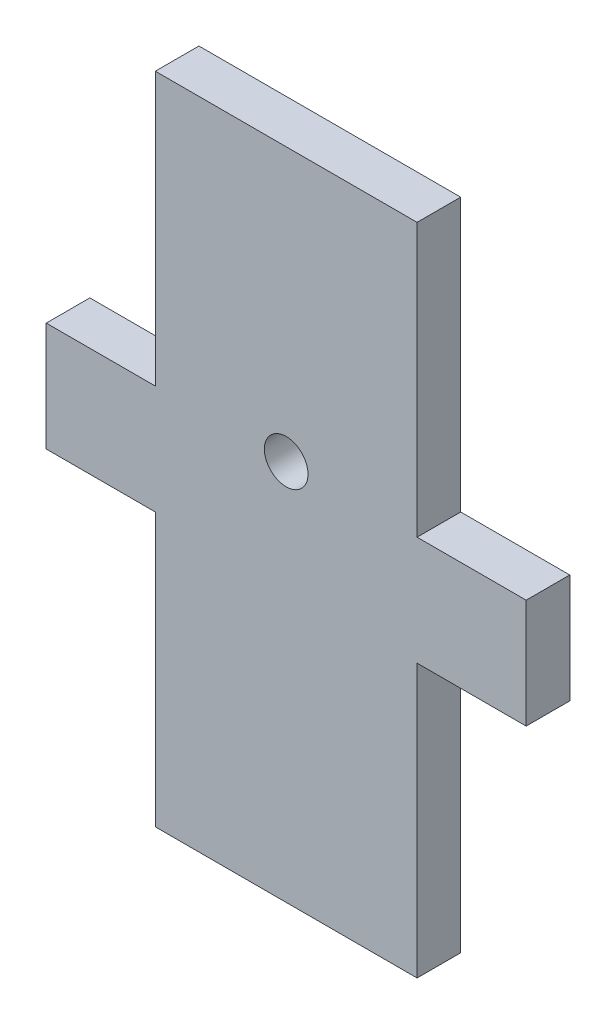
from build123d import *

# Parameters (mm, degrees)
SKETCH1_W           = 60
SKETCH1_H           = 150
BOSS_EXTRUDE1_DEPTH = 10
BOSS_EXTRUDE2_DEPTH = 10
SKETCH3_R           = 5
CUT_EXTRUDE1_DEPTH  = 10


with BuildPart() as part:
    # Sketch1 → Boss-Extrude1 (new body)
    with BuildSketch(Plane.XY):
        Rectangle(SKETCH1_W, SKETCH1_H)
    extrude(amount=-BOSS_EXTRUDE1_DEPTH)

    # Sketch2 → Boss-Extrude2 (add)
    with BuildSketch(Plane.XY):
        Polygon((-30, 12.5), (-30, -12.5), (-55, -12.5), (-55, 0), (-55, 12.5), align=None)
        Polygon((30, 12.5), (30, -12.5), (55, -12.5), (55, 0), (55, 12.5), align=None)
    extrude(amount=-BOSS_EXTRUDE2_DEPTH)

    # Sketch3 → Cut-Extrude1 (cut)
    with BuildSketch(Plane.XY):
        with Locations((0, 12.5)):
            Circle(SKETCH3_R)
    extrude(amount=-CUT_EXTRUDE1_DEPTH, mode=Mode.SUBTRACT)


solid = part.part
